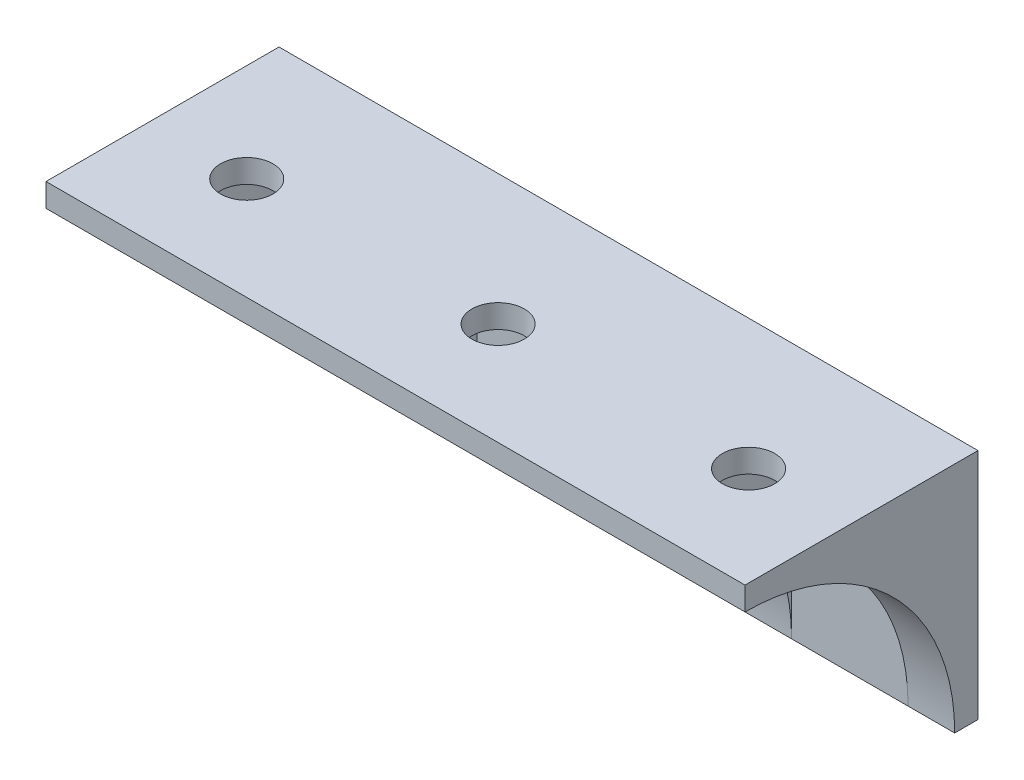
from build123d import *

# Parameters (mm, degrees)
SKETCH_1_W          = 60
SKETCH_1_H          = 20
EXTRUDE_1_DEPTH     = 2
SKETCH_2_W          = 60
SKETCH_2_H          = 2
EXTRUDE_2_DEPTH     = 18
FILLET_1_R          = 18
SKETCH_4_W          = 10
SKETCH_4_H          = 18
SKETCH_4_W_2        = 22
CUT_EXTRUDE_1_DEPTH = 18
HOLE_WIZARD_M4_1_D  = 4.5


with BuildPart() as part:
    # 스케치1 → 보스-돌출1 (new body)
    with BuildSketch(Plane.XY):
        Rectangle(SKETCH_1_W, SKETCH_1_H)
    extrude(amount=EXTRUDE_1_DEPTH)

    # 스케치2 → 보스-돌출2 (add)
    with BuildSketch(Plane.XY.offset(2)):
        with Locations((0, 9)):
            Rectangle(SKETCH_2_W, SKETCH_2_H)
    extrude(amount=EXTRUDE_2_DEPTH)

    # 필렛1
    fillet_1_edges = [part.edges().sort_by_distance(p)[0] for p in [
        (0, 8, 2),
    ]]
    fillet(fillet_1_edges, radius=FILLET_1_R - 0.0001)  # a hair under: the kernel refuses the full size

    # 스케치4 → 컷-돌출1 (cut)
    with BuildSketch(Plane.XY.offset(20)):
        with Locations((-21, -1)):
            Rectangle(SKETCH_4_W, SKETCH_4_H)
        with Locations((0, -1)):
            Rectangle(SKETCH_4_W_2, SKETCH_4_H)
        with Locations((21, -1)):
            Rectangle(SKETCH_4_W, SKETCH_4_H)
    extrude(amount=-CUT_EXTRUDE_1_DEPTH, mode=Mode.SUBTRACT)

    # M4 여유 구멍1 (through all)
    with Locations(Plane(origin=(0, 8, 0), x_dir=(-1, 0, 0), z_dir=(0, -1, 0))):
        with Locations((-21.498688558, -11.191274161), (21.579331698, -11.191274161), (0, -11.191274161)):
            Hole(HOLE_WIZARD_M4_1_D / 2)


solid = part.part
